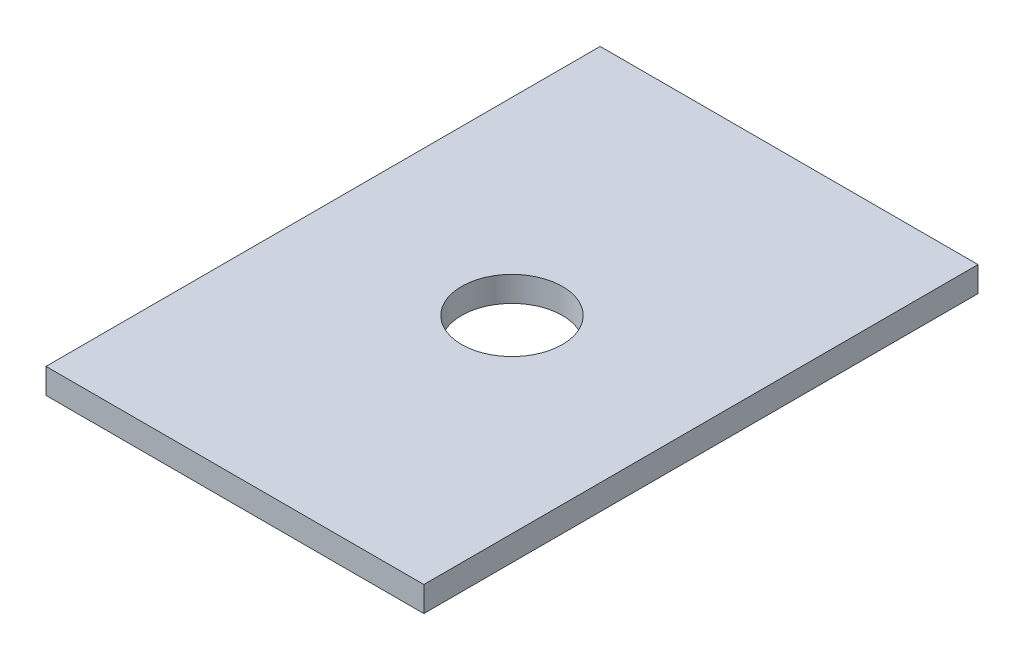
from build123d import *

# Parameters (mm, degrees)
SKETCH2_W           = 150
SKETCH2_H           = 220
SKETCH2_R           = 20
BOSS_EXTRUDE3_DEPTH = 10


with BuildPart() as part:
    # Sketch2 → Boss-Extrude3 (new body)
    with BuildSketch(Plane(origin=(0, 0, 0), x_dir=(1, 0, 0), z_dir=(0, 1, 0))):
        Rectangle(SKETCH2_W, SKETCH2_H)
        Circle(SKETCH2_R, mode=Mode.SUBTRACT)
    extrude(amount=BOSS_EXTRUDE3_DEPTH)


solid = part.part
